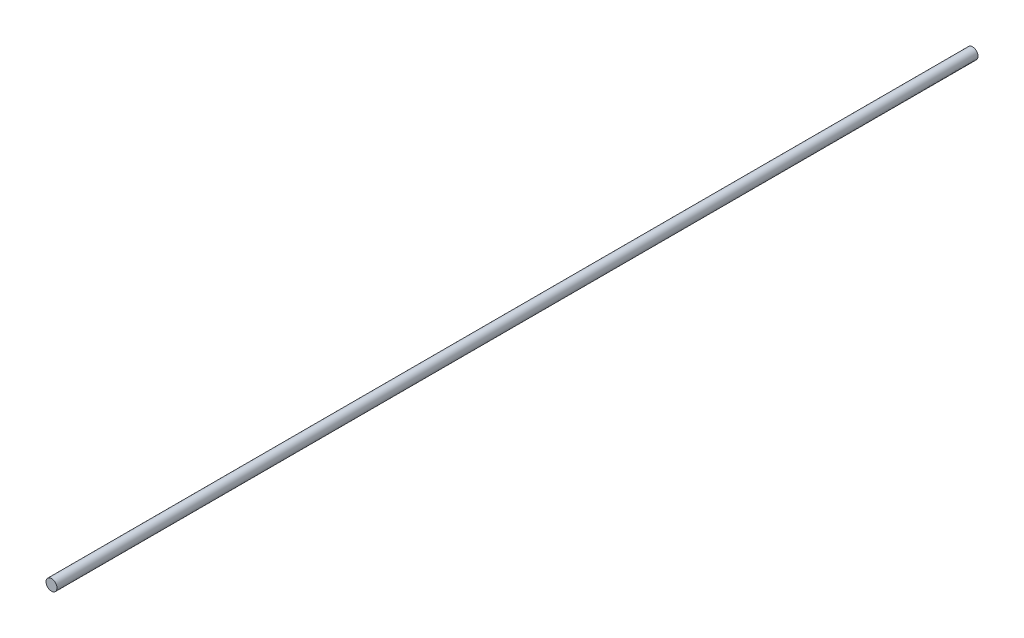
from build123d import *

# Parameters (mm, degrees)
SKETCH1_R           = 1.8161
BOSS_EXTRUDE1_DEPTH = 304.8


with BuildPart() as part:
    # Sketch1 → Boss-Extrude1 (new body)
    with BuildSketch(Plane.XY):
        Circle(SKETCH1_R)
    extrude(amount=BOSS_EXTRUDE1_DEPTH)


solid = part.part
